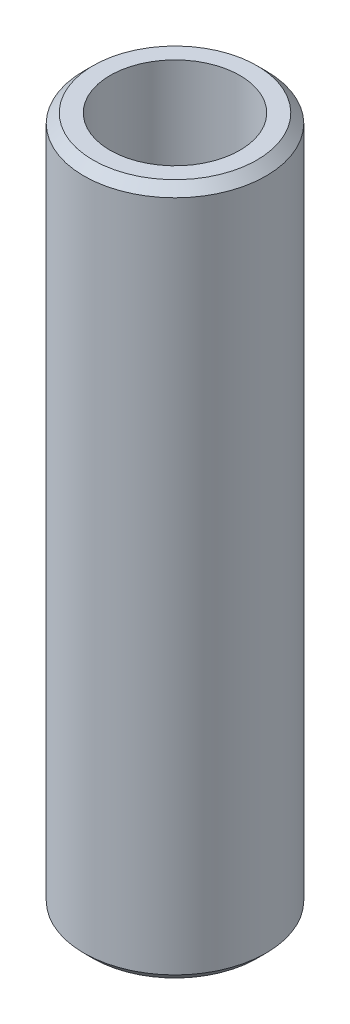
from build123d import *

# Parameters (mm, degrees)
SKETCH1_R           = 47.5
BOSS_EXTRUDE1_DEPTH = 360.63536838
SKETCH2_R           = 33.84806943
CUT_EXTRUDE1_DEPTH  = 367.83834168
CHAMFER1_SIZE       = 4.789073375


with BuildPart() as part:
    # Sketch1 → Boss-Extrude1 (new body)
    with BuildSketch(Plane(origin=(0, 0, 0), x_dir=(1, 0, 0), z_dir=(0, 1, 0))):
        Circle(SKETCH1_R)
    extrude(amount=BOSS_EXTRUDE1_DEPTH)

    # Sketch2 → Cut-Extrude1 (cut, through all)
    with BuildSketch(Plane(origin=(0, 0, 0), x_dir=(1, 0, 0), z_dir=(0, 1, 0))):
        Circle(SKETCH2_R)
    extrude(amount=CUT_EXTRUDE1_DEPTH, mode=Mode.SUBTRACT)

    # Chamfer1
    chamfer1_edges = [part.edges().sort_by_distance(p)[0] for p in [
        (-47.5, 360.63536838, 0),
        (-47.5, 0, 0),
    ]]
    chamfer(chamfer1_edges, length=CHAMFER1_SIZE)


solid = part.part
